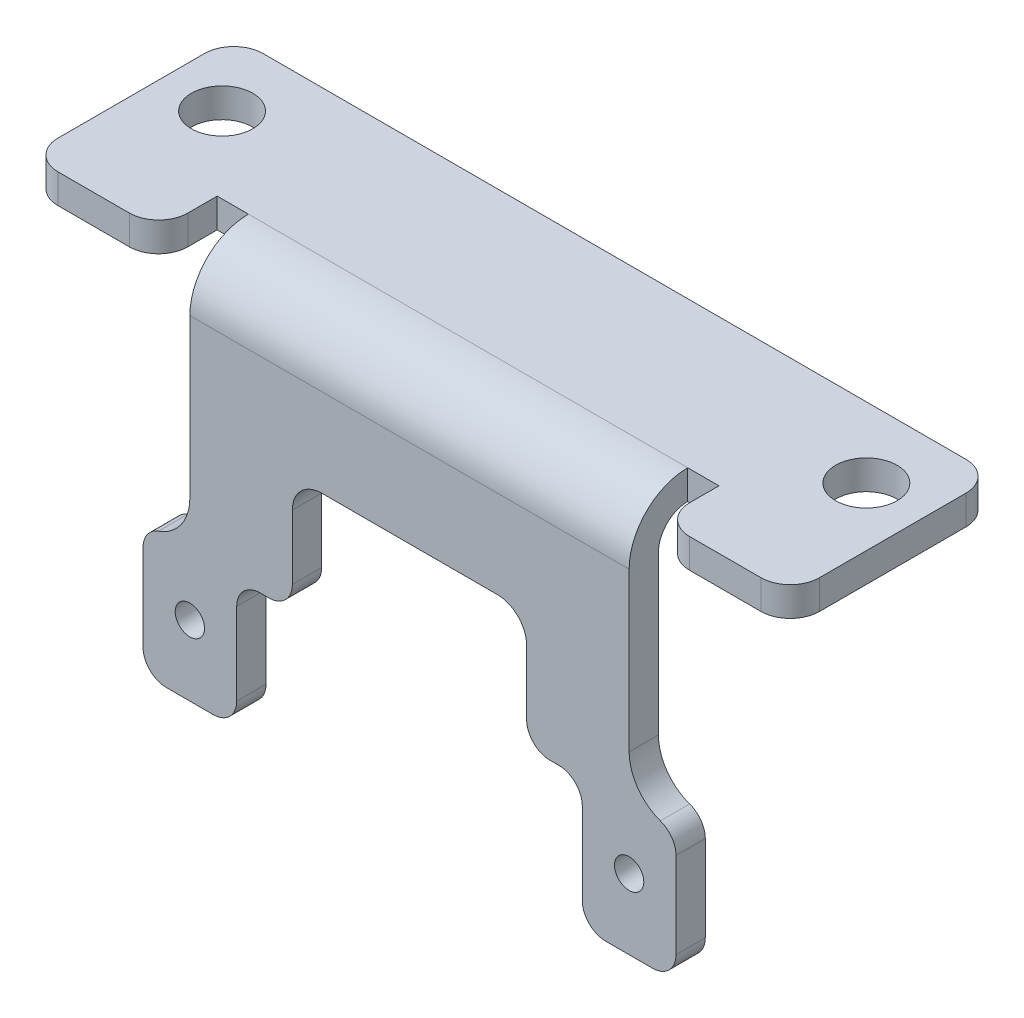
from build123d import *

# Parameters (mm, degrees)
ESQUISSE1_R                           = 2.5
T_LE_DE_BASE_PLI_E1_DEPTH             = 5
T_LE_PLI_E_SUR_AR_TE1_STRIP_W         = 30
T_LE_PLI_E_SUR_AR_TE1_STRIP_H         = 5
T_LE_PLI_E_SUR_AR_TE1_STRIP_CUT_DEPTH = 130
T_LE_PLI_E_SUR_AR_TE1_DEPTH           = 130
CONG_1_R                              = 5
ESQUISSE7_R                           = 5.25
EXTRUSION2_DEPTH                      = 10
ESQUISSE8_W                           = 27.5
ESQUISSE8_H                           = 20
EXTRUSION3_DEPTH                      = 10
PATTE1_DEPTH                          = 5


# Sheet-metal steps are written as plain solids
with BuildPart() as part:
    # Esquisse1 → Tôle de base pliée1 (new body)
    with BuildSketch(Plane.XY):
        with BuildLine():
            Line((29.5, 6), (29.5, -8))
            ThreePointArc((29.5, -8), (30.671572875, -10.828427125), (33.5, -12))
            Line((33.5, -12), (41.5, -12))
            ThreePointArc((41.5, -12), (44.328427125, -10.828427125), (45.5, -8))
            Line((45.5, -8), (45.5, 6.686291501))
            ThreePointArc((45.5, 6.686291501), (44.765986324, 8.995692578), (42.833333333, 10.457527667))
            ThreePointArc((42.833333333, 10.457527667), (38.968027353, 13.381197846), (37.5, 18))
            Line((37.5, 18), (37.5, 35))
            ThreePointArc((37.5, 35), (40.428932188, 42.071067812), (47.5, 45))
            Line((47.5, 45), (65, 45))
            Line((65, 45), (65, 50))
            Line((65, 50), (-65, 50))
            Line((-65, 50), (-65, 45))
            Line((-65, 45), (-47.5, 45))
            ThreePointArc((-47.5, 45), (-40.428932188, 42.071067812), (-37.5, 35))
            Line((-37.5, 35), (-37.5, 18))
            ThreePointArc((-37.5, 18), (-38.968027353, 13.381197846), (-42.833333333, 10.457527667))
            ThreePointArc((-42.833333333, 10.457527667), (-44.765986324, 8.995692578), (-45.5, 6.686291501))
            Line((-45.5, 6.686291501), (-45.5, -8))
            ThreePointArc((-45.5, -8), (-44.328427125, -10.828427125), (-41.5, -12))
            Line((-41.5, -12), (-33.5, -12))
            ThreePointArc((-33.5, -12), (-30.671572875, -10.828427125), (-29.5, -8))
            Line((-29.5, -8), (-29.5, 6))
            ThreePointArc((-29.5, 6), (-28.328427125, 8.828427125), (-25.5, 10))
            Line((-25.5, 10), (-24, 10))
            ThreePointArc((-24, 10), (-21.171572875, 11.171572875), (-20, 14))
            Line((-20, 14), (-20, 25))
            ThreePointArc((-20, 25), (-18.535533906, 28.535533906), (-15, 30))
            Line((-15, 30), (15, 30))
            ThreePointArc((15, 30), (18.535533906, 28.535533906), (20, 25))
            Line((20, 25), (20, 14))
            ThreePointArc((20, 14), (21.171572875, 11.171572875), (24, 10))
            Line((24, 10), (25.5, 10))
            ThreePointArc((25.5, 10), (28.328427125, 8.828427125), (29.5, 6))
        make_face()
        with Locations((37.5, 0)):
            Circle(ESQUISSE1_R, mode=Mode.SUBTRACT)
        with Locations(Location((-37.5, 0, 0), (0, 0, 180))):
            Circle(ESQUISSE1_R, mode=Mode.SUBTRACT)
    extrude(amount=T_LE_DE_BASE_PLI_E1_DEPTH)

    # Tôle pliée sur arête1 strip (across the edge) → Tôle pliée sur arête1 strip cut (cut)
    with BuildSketch(Plane(origin=(-65, 50, 0), x_dir=(0, -1, 0), z_dir=(1, 0, 0))):
        with Locations((-10, -2.5)):
            Rectangle(T_LE_PLI_E_SUR_AR_TE1_STRIP_W, T_LE_PLI_E_SUR_AR_TE1_STRIP_H)
    extrude(amount=T_LE_PLI_E_SUR_AR_TE1_STRIP_CUT_DEPTH, mode=Mode.SUBTRACT)

    # Tôle pliée sur arête1 section (across the edge) → Tôle pliée sur arête1 (add)
    with BuildSketch(Plane(origin=(-65, 50, 0), x_dir=(0, -1, 0), z_dir=(1, 0, 0))):
        with BuildLine():
            Line((-5, 5), (-5, 30))
            Line((-5, 30), (0, 30))
            Line((0, 30), (0, 5))
            ThreePointArc((0, 5), (1.464466094, 1.464466094), (5, 0))
            Line((5, 0), (5, -5))
            ThreePointArc((5, -5), (-2.071067812, -2.071067812), (-5, 5))
        make_face()
    extrude(amount=T_LE_PLI_E_SUR_AR_TE1_DEPTH)

    # Congé1
    cong_1_edges = [part.edges().sort_by_distance(p)[0] for p in [
        (-65, 45, 2.5),
        (65, 45, 2.5),
        (-65, 52.5, -30),
        (65, 52.5, -30),
    ]]
    fillet(cong_1_edges, radius=CONG_1_R - 0.0001)  # a hair under: the kernel refuses the full size

    # Esquisse7 → Extrusion2 (cut)
    with BuildSketch(Plane(origin=(0, 55, 0), x_dir=(1, 0, 0), z_dir=(0, 1, 0))):
        with Locations(Location((55, 18, 0), (0, 0, 270))):
            Circle(ESQUISSE7_R)
        with Locations(Location((-55, 18, 0), (0, 0, 90))):
            Circle(ESQUISSE7_R)
    extrude(amount=-EXTRUSION2_DEPTH, mode=Mode.SUBTRACT)

    # Esquisse8 → Extrusion3 (cut)
    with BuildSketch(Plane.XY.offset(5)):
        with Locations((51.25, 45)):
            Rectangle(ESQUISSE8_W, ESQUISSE8_H)
        with Locations((-51.25, 45)):
            Rectangle(ESQUISSE8_W, ESQUISSE8_H)
    extrude(amount=-EXTRUSION3_DEPTH, mode=Mode.SUBTRACT)

    # Esquisse9 → Patte1 (add)
    with BuildSketch(Plane(origin=(0, 55, 0), x_dir=(1, 0, 0), z_dir=(0, 1, 0))):
        with BuildLine():
            Line((-65, 5), (-42.833333333, 5))
            Line((-42.833333333, 5), (-42.833333333, 0))
            ThreePointArc((-42.833333333, 0), (-44.297799427, -3.535533906), (-47.833333333, -5))
            Line((-47.833333333, -5), (-60, -5))
            ThreePointArc((-60, -5), (-63.535533906, -3.535533906), (-65, 0))
            Line((-65, 0), (-65, 5))
        make_face()
        with BuildLine():
            Line((65, 5), (42.833333333, 5))
            Line((42.833333333, 5), (42.833333333, 0))
            ThreePointArc((42.833333333, 0), (44.297799427, -3.535533906), (47.833333333, -5))
            Line((47.833333333, -5), (60, -5))
            ThreePointArc((60, -5), (63.535533906, -3.535533906), (65, 0))
            Line((65, 0), (65, 5))
        make_face()
    extrude(amount=-PATTE1_DEPTH)


solid = part.part
